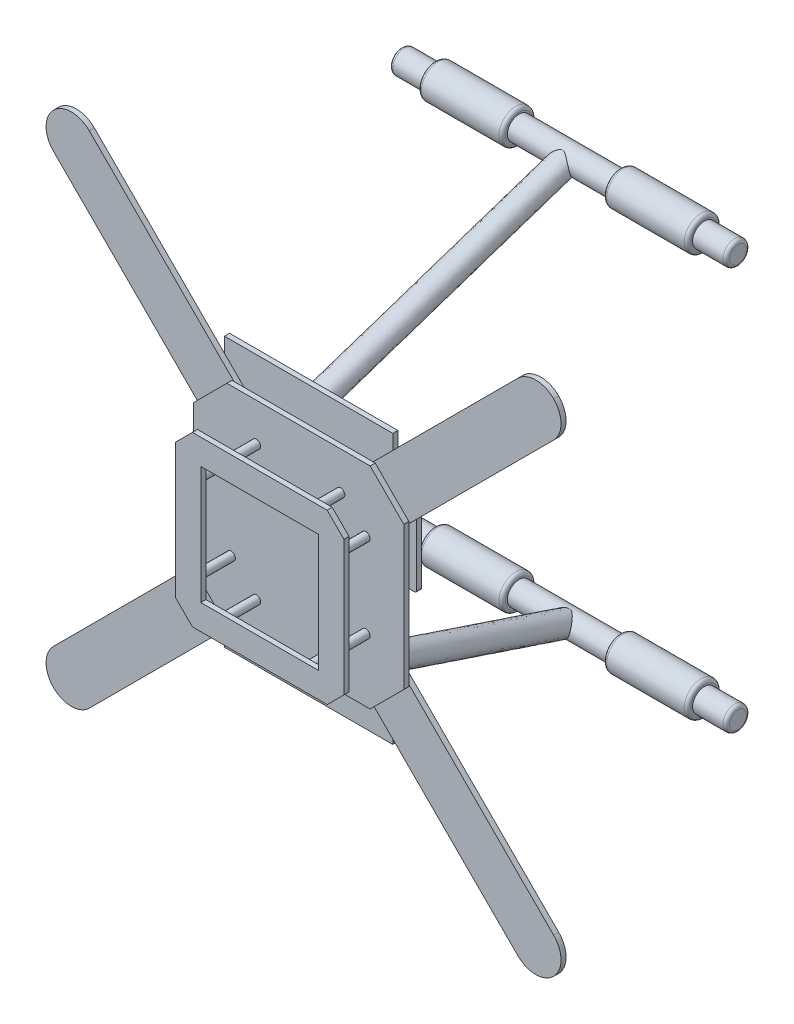
from build123d import *
from build123d.topology import SkipClean

# Parameters (mm, degrees)
SKETCH_1_W                  = 64
SKETCH_1_H                  = 54.15
EXTRUDE_1_DEPTH             = 3
SKETCH_2_R                  = 2
EXTRUDE_2_DEPTH             = 35
MIRROR_2_COPY_1_SKETCH_R    = 2
MIRROR_2_COPY_1_DEPTH       = 35
SKETCH_3_W                  = 125
SKETCH_3_H                  = 125
EXTRUDE_3_DEPTH             = 3
EXTRUDE_4_DEPTH             = 3
FILLET_1_R                  = 15
FILLET_1_OF_MIRROR_3_R      = 15
MIRROR_START                = 35
MIRROR_4_DEPTH              = 3
CHAMFER_1_SIZE              = 20
EXTRUDE_5_DEPTH             = 20
MIRROR_6_COPY_1_DEPTH       = 20
SKETCH_7_W                  = 100
SKETCH_7_H                  = 100
EXTRUDE_6_DEPTH             = 3
SKETCH_8_W                  = 100
SKETCH_8_H                  = 160
EXTRUDE_7_DEPTH             = 3
CHAMFER_2_SIZE              = 10
SKETCH_9_R                  = 7
EXTRUDE_8_DEPTH             = 100
SKETCH_12_R                 = 10
EXTRUDE_9_DEPTH             = 50
MIRROR_8_COPY_1_SKETCH_R    = 10
MIRROR_8_COPY_1_DEPTH       = 50
FILLET_2_R                  = 2
SKETCH_13_W                 = 70
SKETCH_13_H                 = 70
CUT_EXTRUDE_1_DEPTH         = 10
HOLE_WIZARD_M3_1_AT_2_COUNT = 2
HOLE_WIZARD_M3_1_AT_2_PITCH = 42
FILLET_3_R                  = 1
CUT_EXTRUDE_2_DEPTH         = 3
SKETCH_17_R                 = 4.75
CUT_EXTRUDE_3_DEPTH         = 10


# Read off the part's stored shape, not the designer's step: 镜向4
with BuildPart() as part:
    # 草图1 → 凸台-拉伸1 (new body)
    with BuildSketch(Plane.XY):
        Rectangle(SKETCH_1_W, SKETCH_1_H)
    extrude(amount=EXTRUDE_1_DEPTH)

    # 草图2 → 凸台-拉伸2 (add)
    with BuildSketch(Plane.XY.offset(3)):
        with Locations((-22, 17.075)):
            Circle(SKETCH_2_R)
    extrude_2 = extrude(amount=EXTRUDE_2_DEPTH)

    # 镜向1: 凸台-拉伸2 across plane
    add(extrude_2.mirror(Plane(origin=(0, 0, 0), x_dir=(0, 0, 1), z_dir=(1, 0, 0))))

    # 镜向2: 凸台-拉伸2 across plane
    add(extrude_2.mirror(Plane.ZX))

    # 镜向2 copy 1 sketch → 镜向2 copy 1 (add)
    with BuildSketch(Plane(origin=(0, 0, 3), x_dir=(-1, 0, 0), z_dir=(0, 0, 1))):
        with Locations((-22, 17.075)):
            Circle(MIRROR_2_COPY_1_SKETCH_R)
    extrude(amount=MIRROR_2_COPY_1_DEPTH)

    # 草图3 → 凸台-拉伸3 (add)
    with BuildSketch(Plane.XY.offset(38)):
        Rectangle(SKETCH_3_W, SKETCH_3_H)
    extrude(amount=EXTRUDE_3_DEPTH)

    # 草图4 → 凸台-拉伸4 (add)
    with BuildSketch(Plane(origin=(0, 0, 38), x_dir=(-1, 0, 0), z_dir=(0, 0, -1))):
        Polygon((137.885822331, 159.099025767), (41.286796564, 62.5), (62.5, 62.5), (62.5, 41.286796564), (159.099025767, 137.885822331), align=None)
        Polygon((41.286796564, 62.5), (24.748737342, 45.961940777), (45.961940777, 24.748737342), (62.5, 41.286796564), (62.5, 62.5), align=None)
    extrude_4 = extrude(amount=EXTRUDE_4_DEPTH)

    # 圆角1
    fillet_1_edges = [part.edges().sort_by_distance(p)[0] for p in [
        (-137.885822331, 159.099025767, 36.5),
        (-159.099025767, 137.885822331, 36.5),
    ]]
    fillet(fillet_1_edges, radius=FILLET_1_R - 0.0001)  # a hair under: the kernel refuses the full size

    # 镜向3: 凸台-拉伸4 across plane
    add(extrude_4.mirror(Plane(origin=(0, 0, 0), x_dir=(0, 0, 1), z_dir=(1, 0, 0))))

    # 圆角1 of 镜向3
    fillet_1_of_mirror_3_edges = [part.edges().sort_by_distance(p)[0] for p in [
        (137.885822331, 159.099025767, 36.5),
        (159.099025767, 137.885822331, 36.5),
    ]]
    fillet(fillet_1_of_mirror_3_edges, radius=FILLET_1_OF_MIRROR_3_R - 0.0001)  # a hair under: the kernel refuses the full size

    # 镜向4 outline → 镜向4 (add)
    with BuildSketch(Plane.XY.offset(MIRROR_START)):
        with BuildLine():
            ThreePointArc((148.492424049, -148.492424049), (152.885822331, -137.885822331), (148.492424049, -127.279220614))
            Line((148.492424049, -127.279220614), (45.961940777, -24.748737342))
            Line((45.961940777, -24.748737342), (24.748737342, -45.961940777))
            Line((24.748737342, -45.961940777), (127.279220614, -148.492424049))
            ThreePointArc((127.279220614, -148.492424049), (137.885822331, -152.885822331), (148.492424049, -148.492424049))
        make_face()
        with BuildLine():
            Line((-45.961940777, -24.748737342), (-148.492424049, -127.279220614))
            ThreePointArc((-148.492424049, -127.279220614), (-152.885822331, -137.885822331), (-148.492424049, -148.492424049))
            ThreePointArc((-148.492424049, -148.492424049), (-137.885822331, -152.885822331), (-127.279220614, -148.492424049))
            Line((-127.279220614, -148.492424049), (-24.748737342, -45.961940777))
            Line((-24.748737342, -45.961940777), (-45.961940777, -24.748737342))
        make_face()
    extrude(amount=MIRROR_4_DEPTH)

    # 倒角1
    chamfer_1_edges = [part.edges().sort_by_distance(p)[0] for p in [
        (62.5, -62.5, 39.5),
        (62.5, 62.5, 39.5),
        (-62.5, 62.5, 39.5),
        (-62.5, -62.5, 39.5),
    ]]
    chamfer(chamfer_1_edges, length=CHAMFER_1_SIZE)

    # 草图6 → 凸台-拉伸5 (add)
    with BuildSketch(Plane.XY.offset(41)):
        with BuildLine():
            ThreePointArc((-40, 27.5), (-42.5, 25), (-40, 22.5))
            Line((-40, 22.5), (-40, 27.5))
        make_face()
        with BuildLine():
            Line((-40, 27.5), (-40, 22.5))
            ThreePointArc((-40, 22.5), (-38.232233047, 23.232233047), (-37.5, 25))
            ThreePointArc((-37.5, 25), (-38.232233047, 26.767766953), (-40, 27.5))
        make_face()
        with BuildLine():
            ThreePointArc((-27.5, 40), (-25, 37.5), (-22.5, 40))
            Line((-22.5, 40), (-27.5, 40))
        make_face()
        with BuildLine():
            Line((-27.5, 40), (-22.5, 40))
            ThreePointArc((-22.5, 40), (-25, 42.5), (-27.5, 40))
        make_face()
    extrude_5 = extrude(amount=EXTRUDE_5_DEPTH)

    # 镜向5: 凸台-拉伸5 across plane
    add(extrude_5.mirror(Plane.ZX))

    # 镜向6: 凸台-拉伸5 across plane
    add(extrude_5.mirror(Plane(origin=(0, 0, 0), x_dir=(0, 0, 1), z_dir=(1, 0, 0))))

    # 镜向6 copy 1 sketch → 镜向6 copy 1 (add)
    with BuildSketch(Plane(origin=(0, 0, 41), x_dir=(-1, 0, 0), z_dir=(0, 0, 1))):
        with BuildLine():
            ThreePointArc((-40, 27.5), (-42.5, 25), (-40, 22.5))
            Line((-40, 22.5), (-40, 27.5))
        make_face()
        with BuildLine():
            Line((-40, 27.5), (-40, 22.5))
            ThreePointArc((-40, 22.5), (-38.232233047, 23.232233047), (-37.5, 25))
            ThreePointArc((-37.5, 25), (-38.232233047, 26.767766953), (-40, 27.5))
        make_face()
        with BuildLine():
            ThreePointArc((-27.5, 40), (-25, 37.5), (-22.5, 40))
            Line((-22.5, 40), (-27.5, 40))
        make_face()
        with BuildLine():
            Line((-27.5, 40), (-22.5, 40))
            ThreePointArc((-22.5, 40), (-25, 42.5), (-27.5, 40))
        make_face()
    extrude(amount=MIRROR_6_COPY_1_DEPTH)

    # 草图7 → 凸台-拉伸6 (add)
    with BuildSketch(Plane.XY.offset(61)):
        Rectangle(SKETCH_7_W, SKETCH_7_H)
    extrude(amount=EXTRUDE_6_DEPTH)

    # 草图8 → 凸台-拉伸7 (add)
    with BuildSketch(Plane(origin=(0, 0, 35), x_dir=(-1, 0, 0), z_dir=(0, 0, -1))):
        Rectangle(SKETCH_8_W, SKETCH_8_H)
    extrude(amount=EXTRUDE_7_DEPTH)

    # 倒角2
    chamfer_2_edges = [part.edges().sort_by_distance(p)[0] for p in [
        (-50, 50, 62.5),
        (-50, -50, 62.5),
        (50, -50, 62.5),
        (50, 50, 62.5),
    ]]
    chamfer(chamfer_2_edges, length=CHAMFER_2_SIZE)

    # 扫描1: sweep along a path in 草图10
    with BuildLine(Plane(origin=(0, 0, 0), x_dir=(0, 0, -1), z_dir=(1, 0, 0))) as sweep_1_path:
        Line((-32, -69.333333333), (120, -120))
    # 草图9 → 扫描1 (sweep)
    with BuildSketch(Plane(origin=(0, 0, 32), x_dir=(-1, 0, 0), z_dir=(0, 0, -1))):
        with Locations((0, -69)):
            Circle(SKETCH_9_R)
    sweep_1 = sweep(path=sweep_1_path.line)

    # 草图11 → 凸台-拉伸8 (add, symmetric)
    with SkipClean():  # the faces are left unmerged after this step: merging them gives an invalid solid
        with BuildSketch(Plane(origin=(0, 0, 0), x_dir=(0, 0, -1), z_dir=(1, 0, 0))):
            with BuildLine():
                ThreePointArc((120, -112.666666667), (113, -119.666666667), (120, -126.666666667))
                Line((120, -126.666666667), (120, -112.666666667))
            make_face()
            with BuildLine():
                Line((120, -112.666666667), (120, -126.666666667))
                ThreePointArc((120, -126.666666667), (124.949747468, -124.616414135), (127, -119.666666667))
                ThreePointArc((127, -119.666666667), (124.949747468, -114.716919198), (120, -112.666666667))
            make_face()
        extrude_8 = extrude(amount=EXTRUDE_8_DEPTH, both=True)

    # 草图12 → 凸台-拉伸9 (add)
    with SkipClean():  # the faces are left unmerged after this step: merging them gives an invalid solid
        with BuildSketch(Plane.ZY.offset(80)):
            with Locations((-120, -119.666666667)):
                Circle(SKETCH_12_R)
        extrude_9 = extrude(amount=-EXTRUDE_9_DEPTH)

    # 镜向7: 凸台-拉伸9 across plane
    with SkipClean():  # the faces are left unmerged after this step: merging them gives an invalid solid
        add(extrude_9.mirror(Plane(origin=(0, 0, 0), x_dir=(0, 0, 1), z_dir=(1, 0, 0))))

    # 镜向8: 扫描1, 凸台-拉伸8, 凸台-拉伸9 across plane
    with SkipClean():  # the faces are left unmerged after this step: merging them gives an invalid solid
        add(sweep_1.mirror(Plane.ZX))
        add(extrude_8.mirror(Plane.ZX))
        add(extrude_9.mirror(Plane.ZX))

    # 镜向8 copy 1 sketch → 镜向8 copy 1 (add)
    with SkipClean():  # the faces are left unmerged after this step: merging them gives an invalid solid
        with BuildSketch(Plane(origin=(80, 0, 0), x_dir=(0, 0, 1), z_dir=(1, 0, 0))):
            with Locations((-120, -119.666666667)):
                Circle(MIRROR_8_COPY_1_SKETCH_R)
        extrude(amount=-MIRROR_8_COPY_1_DEPTH)

    # 圆角2
    fillet_2_edges = [part.edges().sort_by_distance(p)[0] for p in [
        (-100, -114.716919198, -124.949747468),
        (100, -114.716919198, -124.949747468),
        (-30, -119.666666667, -130),
        (-80, -119.666666667, -130),
        (80, -119.666666667, -130),
        (30, -119.666666667, -130),
        (100, 114.716919198, -124.949747468),
        (-100, 114.716919198, -124.949747468),
        (-80, 119.666666667, -130),
        (-30, 119.666666667, -130),
        (30, 119.666666667, -130),
        (80, 119.666666667, -130),
    ]]
    fillet(fillet_2_edges, radius=FILLET_2_R)

    # 草图13 → 切除-拉伸1 (cut)
    with BuildSketch(Plane.XY.offset(64)):
        Rectangle(SKETCH_13_W, SKETCH_13_H)
    extrude(amount=-CUT_EXTRUDE_1_DEPTH, mode=Mode.SUBTRACT)

    # 草图15 → M3 螺纹孔1 (revolve, cut)
    with BuildSketch(Plane(origin=(26, -21, 0), x_dir=(0, 1, 0), z_dir=(1, 0, 0))):
        Polygon((0, 0), (0, 8.251075774), (1.25, 7.5), (1.25, 0), align=None)
    hole_wizard_m3_1 = revolve(axis=Axis((26, -21, -6.35), (0, 0, 1)), mode=Mode.SUBTRACT)

    # M3 螺纹孔1 at 2: M3 螺纹孔1 ×2
    with Locations(*[(0, i * HOLE_WIZARD_M3_1_AT_2_PITCH, 0) for i in range(1, HOLE_WIZARD_M3_1_AT_2_COUNT)]):
        add(hole_wizard_m3_1, mode=Mode.SUBTRACT)

    # 镜向9: M3 螺纹孔1 across plane
    add(hole_wizard_m3_1.mirror(Plane(origin=(0, 0, 0), x_dir=(0, 0, 1), z_dir=(1, 0, 0))), mode=Mode.SUBTRACT)

    # 镜向9 copy 1 sketch → 镜向9 copy 1 (revolve, cut)
    with BuildSketch(Plane(origin=(-26, 21, 0), x_dir=(0, 1, 0), z_dir=(-1, 0, 0))):
        Polygon((0, 0), (0, -8.251075774), (1.25, -7.5), (1.25, 0), align=None)
    revolve(axis=Axis((-26, 21, -6.35), (0, 0, -1)), mode=Mode.SUBTRACT)

    # 圆角3
    fillet_3_edges = [part.edges().sort_by_distance(p)[0] for p in [
        (-32, 27.075, 1.5),
        (32, 27.075, 1.5),
        (32, -27.075, 1.5),
        (-32, -27.075, 1.5),
    ]]
    fillet(fillet_3_edges, radius=FILLET_3_R)

    # 草图16 → 切除-拉伸2 (cut)
    with SkipClean():  # the faces are left unmerged after this step: merging them gives an invalid solid
        with BuildSketch(Plane(origin=(0, 0, 0), x_dir=(-1, 0, 0), z_dir=(0, 0, -1))):
            with BuildLine():
                Line((-20, -19.25), (20, -19.25))
                ThreePointArc((20, -19.25), (21.75, -21), (20, -22.75))
                Line((20, -22.75), (-20, -22.75))
                ThreePointArc((-20, -22.75), (-21.75, -21), (-20, -19.25))
            make_face()
        cut_extrude_2 = extrude(amount=-CUT_EXTRUDE_2_DEPTH, mode=Mode.SUBTRACT)

    # 镜向10: 切除-拉伸2 across plane
    with SkipClean():  # the faces are left unmerged after this step: merging them gives an invalid solid
        add(cut_extrude_2.mirror(Plane.ZX), mode=Mode.SUBTRACT)

    # 草图17 → 切除-拉伸3 (cut)
    with SkipClean():  # the faces are left unmerged after this step: merging them gives an invalid solid
        with BuildSketch(Plane(origin=(0, 0, 0), x_dir=(-1, 0, 0), z_dir=(0, 0, -1))):
            Circle(SKETCH_17_R)
        extrude(amount=-CUT_EXTRUDE_3_DEPTH, mode=Mode.SUBTRACT)


solid = part.part
